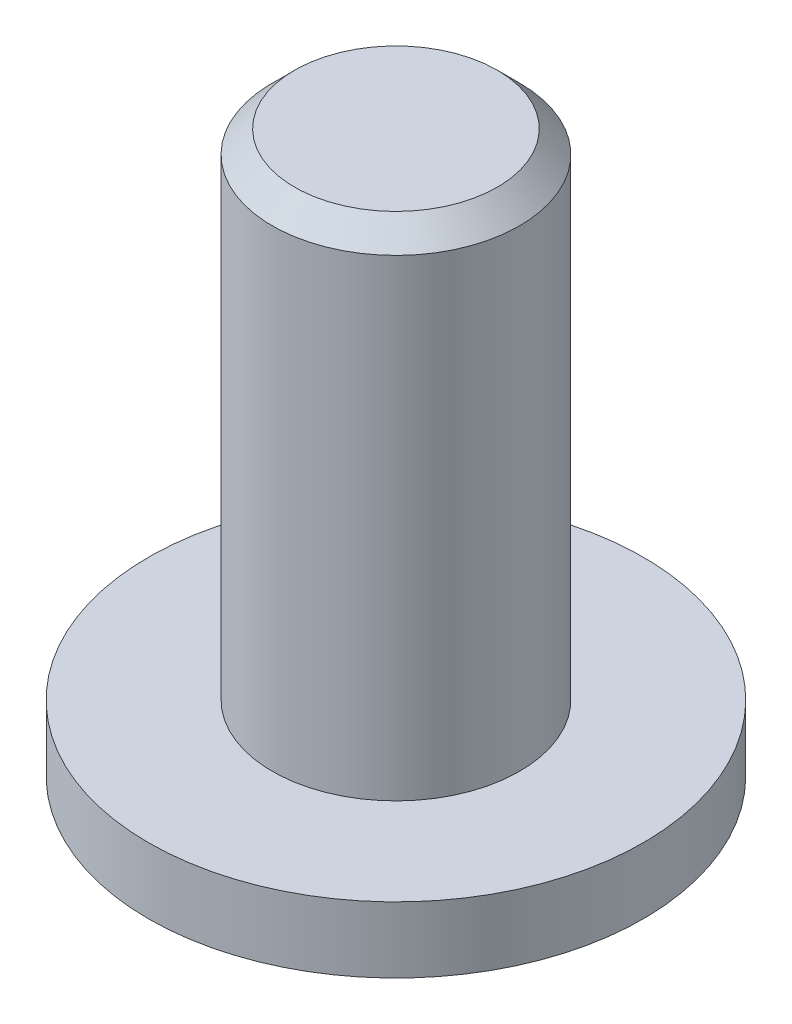
from build123d import *

# Parameters (mm, degrees)
SKETCH_1_R          = 3
EXTRUDE_1_DEPTH     = 0.8
CUT_EXTRUDE_1_DEPTH = 0.5


# Read off the part's stored shape, not the designer's step: M3 机械螺纹 螺柱3
with BuildPart() as part:
    # 草图1 → 凸台-拉伸1 (new body)
    with BuildSketch(Plane(origin=(0, 0, 0), x_dir=(1, 0, 0), z_dir=(0, 1, 0))):
        with Locations(Location((0, 0, 0), (0, 0, 270))):
            Circle(SKETCH_1_R)
    extrude(amount=EXTRUDE_1_DEPTH)

    # M3 机械螺纹 螺柱3 outline → M3 机械螺纹 螺柱3 (revolve)
    with BuildSketch(Plane.XY):
        Polygon((1.2295, 6.8), (0, 6.8), (0, 0.8), (1.5, 0.8), (1.5, 6.5295), align=None)
    revolve(axis=Axis((0, 0, 0), (0, 1, 0)))

    # 草图8 → 切除-拉伸1 (cut)
    with BuildSketch(Plane.XZ):
        Polygon((1.154700538, 0), (0.577350269, 1), (-0.577350269, 1), (-1.154700538, 0), (-0.577350269, -1), (0.577350269, -1), align=None)
    extrude(amount=-CUT_EXTRUDE_1_DEPTH, mode=Mode.SUBTRACT)


solid = part.part
